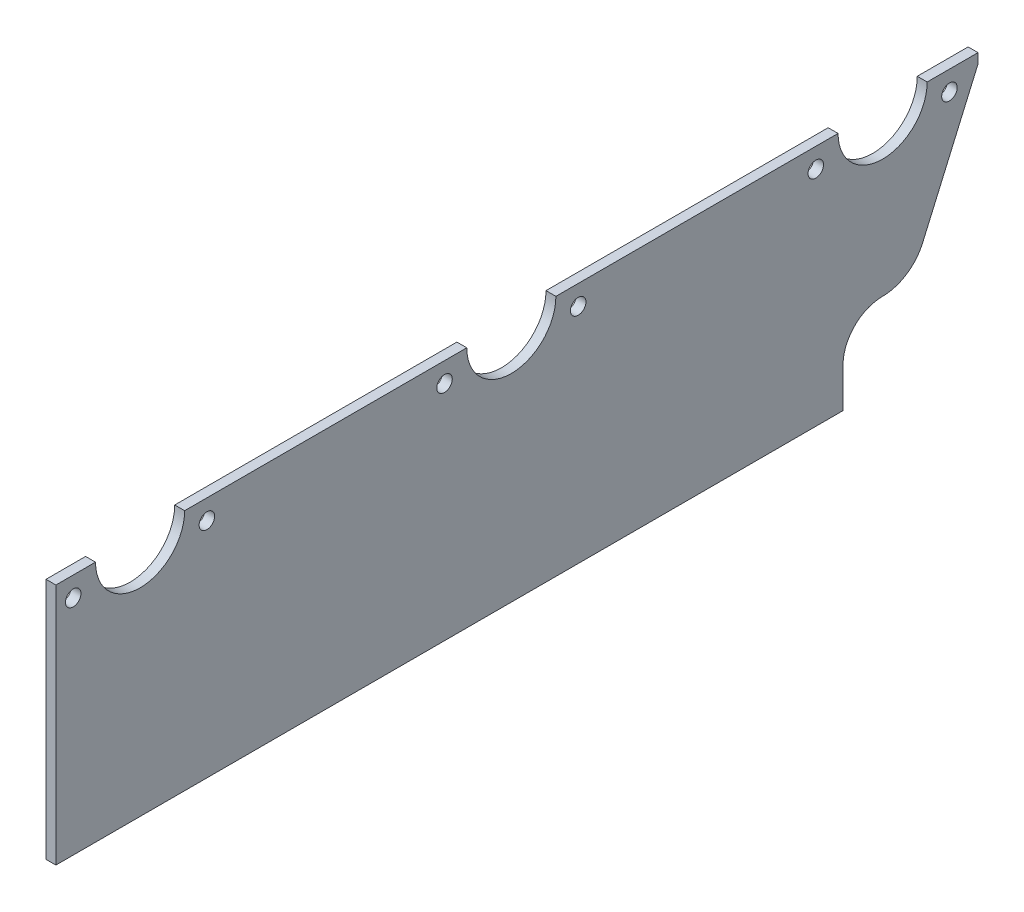
from build123d import *

# Parameters (mm, degrees)
BOSS_EXTRUDE1_DEPTH    = 3.175
F_10_CLEARANCE_HOLE1_D = 4.9784


with BuildPart() as part:
    # Sketch1 → Boss-Extrude1 (new body)
    with BuildSketch(Plane(origin=(0, 0, 0), x_dir=(0, 0, -1), z_dir=(1, 0, 0))):
        with BuildLine():
            Line((-12.7, -12.7), (-265.1125, -12.7))
            Line((-265.1125, -12.7), (-265.1125, 65.0875))
            Line((-265.1125, 65.0875), (-252.4125, 65.0875))
            ThreePointArc((-252.4125, 65.0875), (-238.125, 50.8), (-223.8375, 65.0875))
            Line((-223.8375, 65.0875), (-133.35, 65.0875))
            ThreePointArc((-133.35, 65.0875), (-119.0625, 50.8), (-104.775, 65.0875))
            Line((-104.775, 65.0875), (-14.2875, 65.0875))
            ThreePointArc((-14.2875, 65.0875), (0, 50.8), (14.2875, 65.0875))
            Line((14.2875, 65.0875), (30.588066622, 65.0875))
            Line((30.588066622, 65.0875), (30.588066622, 61.9125))
            Line((30.588066622, 61.9125), (12.807800672, 21.091367377))
            ThreePointArc((12.807800672, 21.091367377), (7.655958537, 14.984658804), (0, 12.7))
            ThreePointArc((0, 12.7), (-8.980256121, 8.980256121), (-12.7, 0))
            Line((-12.7, 0), (-12.7, -12.7))
        make_face()
    extrude(amount=BOSS_EXTRUDE1_DEPTH)

    # #10 Clearance Hole1 (through all)
    with Locations(Plane(origin=(3.175, 0, 0), x_dir=(0, 0, -1), z_dir=(1, 0, 0))):
        with Locations((-259.55625, 58.7375), (-216.69375, 58.7375), (-140.49375, 58.7375), (-97.63125, 58.7375), (-21.43125, 58.7375), (21.43125, 58.7375)):
            Hole(F_10_CLEARANCE_HOLE1_D / 2)


solid = part.part
